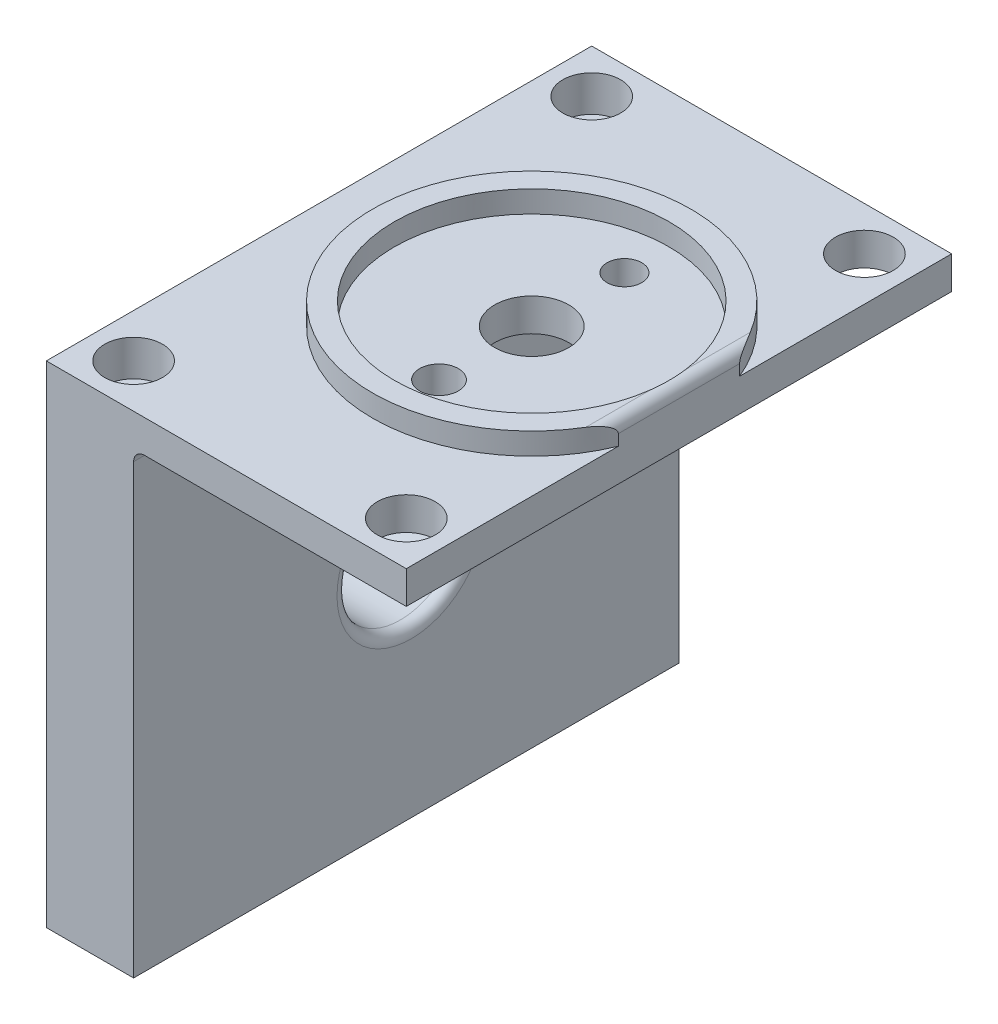
from build123d import *

# Parameters (mm, degrees)
SKETCH1_W           = 25
SKETCH1_H           = 50
SKETCH1_R           = 3.4
BOSS_EXTRUDE1_DEPTH = 3
SKETCH2_W           = 50
SKETCH2_H           = 3
BOSS_EXTRUDE2_DEPTH = 8
SKETCH3_W           = 8
SKETCH3_H           = 50
BOSS_EXTRUDE3_DEPTH = 42
SKETCH4_R           = 2.65
CUT_EXTRUDE1_DEPTH  = 3.3
SKETCH5_R           = 5.802370205
CUT_EXTRUDE2_DEPTH  = 9
FILLET2_R           = 1
SKETCH6_R           = 12.6
BOSS_EXTRUDE4_DEPTH = 2
FILLET3_R           = 1
FILLET4_R           = 1
SKETCH8_R           = 1.589780168
SKETCH8_R_2         = 1.777428262
CUT_EXTRUDE3_DEPTH  = 10


with BuildPart() as part:
    # Sketch1 → Boss-Extrude1 (new body)
    with BuildSketch(Plane(origin=(0, 0, 0), x_dir=(1, 0, 0), z_dir=(0, 1, 0))):
        with Locations((2.276951673, 11.384758364)):
            Rectangle(SKETCH1_W, SKETCH1_H)
        with Locations(Location((1.276951673, 11.384758364, 0), (0, 0, 270))):
            Circle(SKETCH1_R, mode=Mode.SUBTRACT)
    extrude(amount=BOSS_EXTRUDE1_DEPTH)

    # Sketch2 → Boss-Extrude2 (add)
    with BuildSketch(Plane.ZY.offset(10.223048327)):
        with Locations((-11.384758364, 1.5)):
            Rectangle(SKETCH2_W, SKETCH2_H)
    extrude(amount=BOSS_EXTRUDE2_DEPTH)

    # Sketch3 → Boss-Extrude3 (add)
    with BuildSketch(Plane.XZ):
        with Locations((-14.223048327, -11.384758364)):
            Rectangle(SKETCH3_W, SKETCH3_H)
    extrude(amount=BOSS_EXTRUDE3_DEPTH)

    # Sketch4 → Cut-Extrude1 (cut)
    with BuildSketch(Plane(origin=(0, 3, 0), x_dir=(1, 0, 0), z_dir=(0, 1, 0))):
        with Locations(Location((-14.223048327, 32.384758364, 0), (0, 0, 270))):
            Circle(SKETCH4_R)
        with Locations(Location((-14.223048327, -9.615241636, 0), (0, 0, 270))):
            Circle(SKETCH4_R)
    cut_extrude1 = extrude(amount=-CUT_EXTRUDE1_DEPTH, mode=Mode.SUBTRACT)

    # Mirror1: Cut-Extrude1 across plane
    add(cut_extrude1.mirror(Plane.ZX.offset(-19.5)), mode=Mode.SUBTRACT)

    # Sketch5 → Cut-Extrude2 (cut)
    with BuildSketch(Plane.ZY.offset(18.223048327)):
        with Locations((-11.836279124, -21)):
            Circle(SKETCH5_R)
    extrude(amount=-CUT_EXTRUDE2_DEPTH, mode=Mode.SUBTRACT)

    # Fillet2
    fillet2_edges = [part.edges().sort_by_distance(p)[0] for p in [
        (-10.223048327, -21, -17.638649329),
    ]]
    fillet(fillet2_edges, radius=FILLET2_R)

    # Mirror2: Cut-Extrude1 across plane
    add(cut_extrude1.mirror(Plane.ZY.offset(1.723048327)), mode=Mode.SUBTRACT)

    # Sketch6 → Boss-Extrude4 (add)
    with BuildSketch(Plane(origin=(0, 3, 0), x_dir=(1, 0, 0), z_dir=(0, 1, 0))):
        with BuildLine():
            Line((14.776951673, 5.825082115), (14.776951673, 16.944434614))
            ThreePointArc((14.776951673, 16.944434614), (-13.323048327, 11.384758364), (14.776951673, 5.825082115))
        make_face()
        with Locations(Location((1.276951673, 11.384758364, 0), (0, 0, 270))):
            Circle(SKETCH6_R, mode=Mode.SUBTRACT)
    extrude(amount=BOSS_EXTRUDE4_DEPTH)

    # Fillet3
    fillet3_edges = [part.edges().sort_by_distance(p)[0] for p in [
        (-10.223048327, 0, -11.384758364),
    ]]
    fillet(fillet3_edges, radius=FILLET3_R)

    # Fillet4
    # the kernel refuses this fillet: 1 mm, written as the material it takes off along each edge
    with BuildSketch(Plane(origin=(14.776951673, 5, -3.325082115), x_dir=(0, -1, 0), z_dir=(0, 0, -1))) as fillet4_piece_1:
        with BuildLine():
            CenterArc((FILLET4_R, FILLET4_R), FILLET4_R, 180, 90)
            Line((0, FILLET4_R), (0, 0))
            Line((0, 0), (FILLET4_R, 0))
        make_face()
    extrude(amount=16.119352499, mode=Mode.SUBTRACT)

    # Sketch8 → Cut-Extrude3 (cut)
    with BuildSketch(Plane(origin=(0, 3, 0), x_dir=(1, 0, 0), z_dir=(0, 1, 0))):
        with Locations(Location((1.276951673, 19.884758364, 0), (0, 0, 270))):
            Circle(SKETCH8_R)
        with Locations(Location((1.276951673, 2.884758364, 0), (0, 0, 270))):
            Circle(SKETCH8_R_2)
    extrude(amount=-CUT_EXTRUDE3_DEPTH, mode=Mode.SUBTRACT)


solid = part.part
